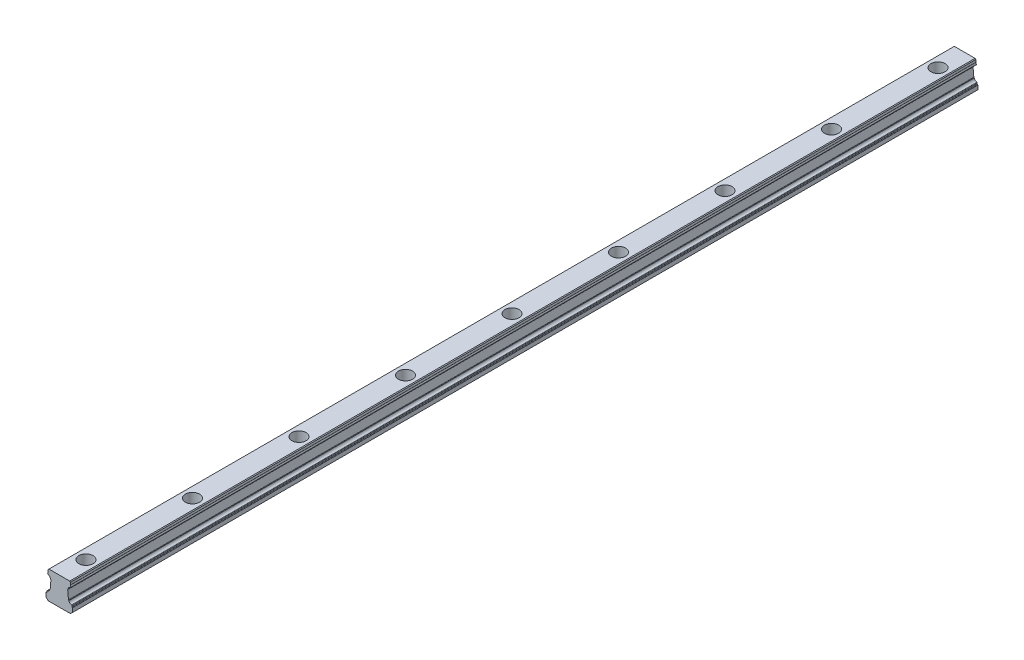
from build123d import *

# Parameters (mm, degrees)
EXTRUDE1_DEPTH        = 255
LPATTERN1_START       = -4.39999151
LPATTERN1_OUTLINE_R   = 4
LPATTERN1_DEPTH       = 6.200000002
LPATTERN1_START_2     = -13.89999151
LPATTERN1_2_OUTLINE_R = 2.25
LPATTERN1_2_DEPTH     = 9.5


# Read off the part's stored shape, not the designer's step: LPattern1
with BuildPart() as part:
    # Sketch1 → Extrude1 (new, symmetric)
    with BuildSketch(Plane.XY):
        with BuildLine():
            Line((6.299999998, -13.89999151), (7.499999673, -12.699991836))
            Line((7.499999673, -12.699991836), (7.499999673, -10.400043863))
            Line((7.499999673, -10.400043863), (7.242437811, -10.331030371))
            ThreePointArc((7.242437811, -10.331030371), (7.108804238, -10.241739271), (7.057142573, -10.089548914))
            Line((7.057142573, -10.089548914), (7.057142573, -9.520416543))
            ThreePointArc((7.057142573, -9.520416543), (6.998907475, -9.367837553), (6.853820755, -9.292860767))
            ThreePointArc((6.853820755, -9.292860767), (5.94454945, -8.885983146), (5.43815048, -8.028146455))
            ThreePointArc((5.43815048, -8.028146455), (5.386062423, -7.939367574), (5.292449295, -7.896572271))
            ThreePointArc((5.292449295, -7.896572271), (5.190381489, -7.845596795), (5.143092926, -7.7417694))
            Line((5.143092926, -7.7417694), (4.728320242, -3.00089593))
            ThreePointArc((4.728320242, -3.00089593), (4.727832289, -2.993451213), (4.727669535, -2.985992298))
            ThreePointArc((4.727669535, -2.985992298), (4.760267524, -2.885563799), (4.845633084, -2.823424974))
            ThreePointArc((4.845633084, -2.823424974), (4.928287775, -2.764919717), (4.963356305, -2.669920448))
            ThreePointArc((4.963356305, -2.669920448), (5.395229732, -1.644926655), (6.381524191, -1.130776701))
            ThreePointArc((6.381524191, -1.130776701), (6.54675572, -1.022271679), (6.565939633, -0.825531303))
            Line((6.565939633, -0.825531303), (6.268091886, -0.007201345))
            ThreePointArc((6.268091886, -0.007201345), (6.254557346, 0.043310245), (6.249999672, 0.095404698))
            Line((6.249999672, 0.095404698), (6.249999672, 1.399956135))
            Line((6.249999672, 1.399956135), (5.850000001, 1.800008492))
            Line((5.850000001, 1.800008492), (-5.849999998, 1.800008492))
            Line((-5.849999998, 1.800008492), (-6.24999967, 1.399956135))
            Line((-6.24999967, 1.399956135), (-6.24999967, 0.095404698))
            ThreePointArc((-6.24999967, 0.095404698), (-6.254557344, 0.043310245), (-6.268091883, -0.007201345))
            Line((-6.268091883, -0.007201345), (-6.56593963, -0.825531303))
            ThreePointArc((-6.56593963, -0.825531303), (-6.546755717, -1.022271679), (-6.381524188, -1.130776701))
            ThreePointArc((-6.381524188, -1.130776701), (-5.39522973, -1.644926655), (-4.963356302, -2.669920448))
            ThreePointArc((-4.963356302, -2.669920448), (-4.928287772, -2.764919717), (-4.845633081, -2.823424974))
            ThreePointArc((-4.845633081, -2.823424974), (-4.760267522, -2.885563799), (-4.727669532, -2.985992298))
            ThreePointArc((-4.727669532, -2.985992298), (-4.727832287, -2.993451213), (-4.728320239, -3.00089593))
            Line((-4.728320239, -3.00089593), (-5.143092923, -7.7417694))
            ThreePointArc((-5.143092923, -7.7417694), (-5.190381487, -7.845596795), (-5.292449292, -7.896572271))
            ThreePointArc((-5.292449292, -7.896572271), (-5.38606242, -7.939367574), (-5.438150478, -8.028146455))
            ThreePointArc((-5.438150478, -8.028146455), (-5.944549448, -8.885983146), (-6.853820752, -9.292860767))
            ThreePointArc((-6.853820752, -9.292860767), (-6.998907472, -9.367837553), (-7.05714257, -9.520416543))
            Line((-7.05714257, -9.520416543), (-7.05714257, -10.089548914))
            ThreePointArc((-7.05714257, -10.089548914), (-7.108804235, -10.241739271), (-7.242437809, -10.331030371))
            Line((-7.242437809, -10.331030371), (-7.49999967, -10.400043863))
            Line((-7.49999967, -10.400043863), (-7.49999967, -12.699991836))
            Line((-7.49999967, -12.699991836), (-6.299999996, -13.89999151))
            Line((-6.299999996, -13.89999151), (6.299999998, -13.89999151))
        make_face()
    extrude(amount=EXTRUDE1_DEPTH, both=True)

    # Sketch2 → Hole1 (revolve, cut)
    with BuildSketch(Plane(origin=(0, 1.800008492, 240), x_dir=(0, 0, 1), z_dir=(1, 0, 0))):
        Polygon((0, 0), (0, 17.051936395), (2.25, 15.700000002), (2.25, 6.200000002), (4, 6.200000002), (4, 0), align=None)
    hole1 = revolve(axis=Axis((0, 13.110883531, 240), (0, -1, 0)), mode=Mode.SUBTRACT)

    # LPattern1 outline → LPattern1 (cut)
    with BuildSketch(Plane(origin=(0, 0, 0), x_dir=(1, 0, 0), z_dir=(0, 1, 0)).offset(LPATTERN1_START)):
        with Locations((0, -180)):
            Circle(LPATTERN1_OUTLINE_R)
        with Locations((0, -120)):
            Circle(LPATTERN1_OUTLINE_R)
        with Locations((0, -60)):
            Circle(LPATTERN1_OUTLINE_R)
        Circle(LPATTERN1_OUTLINE_R)
        with Locations((0, 60)):
            Circle(LPATTERN1_OUTLINE_R)
        with Locations((0, 120)):
            Circle(LPATTERN1_OUTLINE_R)
        with Locations((0, 180)):
            Circle(LPATTERN1_OUTLINE_R)
    extrude(amount=LPATTERN1_DEPTH, mode=Mode.SUBTRACT)

    # LPattern1 2 outline → LPattern1 2 (cut)
    with BuildSketch(Plane(origin=(0, 0, 0), x_dir=(1, 0, 0), z_dir=(0, 1, 0)).offset(LPATTERN1_START_2)):
        with Locations((0, -180)):
            Circle(LPATTERN1_2_OUTLINE_R)
        with Locations((0, -120)):
            Circle(LPATTERN1_2_OUTLINE_R)
        with Locations((0, -60)):
            Circle(LPATTERN1_2_OUTLINE_R)
        Circle(LPATTERN1_2_OUTLINE_R)
        with Locations((0, 60)):
            Circle(LPATTERN1_2_OUTLINE_R)
        with Locations((0, 120)):
            Circle(LPATTERN1_2_OUTLINE_R)
        with Locations((0, 180)):
            Circle(LPATTERN1_2_OUTLINE_R)
    extrude(amount=LPATTERN1_2_DEPTH, mode=Mode.SUBTRACT)

    # A-Mirror1: Hole1 across plane
    add(hole1.mirror(Plane.XY), mode=Mode.SUBTRACT)


solid = part.part
